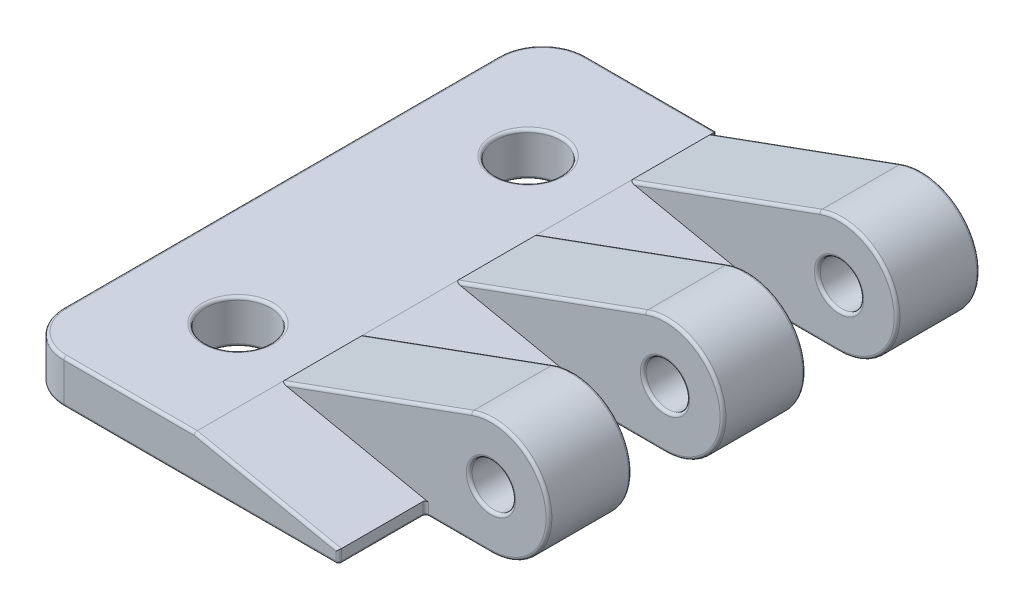
from build123d import *

# Parameters (mm, degrees)
CROQUIS1_R                    = 1.499999999999997
SALIENTE_EXTRUIR1_DEPTH       = 36
CORTAR_EXTRUIR1_DEPTH         = 6.3
MATRIZL1_COUNT                = 3
MATRIZL1_PITCH                = 12
CROQUIS3_R                    = 2.2500000000000053
CROQUIS3_R_2                  = 2.250000000000001
CORTAR_EXTRUIR2_DEPTH         = 48.41052288350405
REDONDEO1_R                   = 3
ESTRUSIONE_ESTRUSIONE1_START  = 0.3
ESTRUSIONE_ESTRUSIONE1_DEPTH  = 0.3
ESTRUSIONE_ESTRUSIONE2_START  = 0.3
ESTRUSIONE_ESTRUSIONE2_DEPTH  = 0.3
ESTRUSIONE_ESTRUSIONE3_START  = 0.3
ESTRUSIONE_ESTRUSIONE3_DEPTH  = 0.3
TAGLIO_ESTRUSIONE1_START      = -0.3
TAGLIO_ESTRUSIONE1_DEPTH      = 0.3
TAGLIO_ESTRUSIONE2_START      = -0.3
TAGLIO_ESTRUSIONE2_DEPTH      = 0.3
TAGLIO_ESTRUSIONE3_START      = -0.3
TAGLIO_ESTRUSIONE3_DEPTH      = 0.3
TAGLIO_ESTRUSIONE4_DEPTH      = 44.69036140943744
TAGLIO_ESTRUSIONE4_DEPTH_BACK = 44.69036140943744
SCHIZZO8_R                    = 1.499999999999997
TAGLIO_ESTRUSIONE5_DEPTH      = 48.82005520790687
TAGLIO_ESTRUSIONE5_DEPTH_BACK = 48.82005520790687
SCHIZZO9_W                    = 4.4999999999999964
SCHIZZO9_H                    = 6.299999999999999
RACCORDO4_R                   = 0.2


with BuildPart() as part:
    # Croquis1 → Saliente-Extruir1 (new body)
    with BuildSketch(Plane.XY):
        with BuildLine():
            Line((25.074614446804567, 7.758770483143642), (12, 3))
            Line((12, 3), (0, 3))
            Line((0, 3), (0, 0))
            Line((0, 0), (26.442695020107216, 8.7e-16))
            ThreePointArc((26.442695020107216, 8.7e-16), (30.381926032156052, 4.69459271066771), (25.074614446804567, 7.758770483143642))
        make_face()
        with Locations((26.442695020107216, 4.000000000000001)):
            Circle(CROQUIS1_R, mode=Mode.SUBTRACT)
    extrude(amount=-SALIENTE_EXTRUIR1_DEPTH)

    # Croquis2 → Cortar-Extruir1 (cut)
    with BuildSketch(Plane.XY):
        with BuildLine():
            Line((12, 3), (26.442695020107216, 8.7e-16))
            ThreePointArc((26.442695020107216, 8.7e-16), (30.381926032156052, 4.694592710667711), (25.074614446804564, 7.758770483143641))
            Line((25.074614446804564, 7.758770483143641), (12, 3))
        make_face()
    cortar_extruir1 = extrude(amount=-CORTAR_EXTRUIR1_DEPTH, mode=Mode.SUBTRACT)

    # MatrizL1: Cortar-Extruir1 ×3
    with Locations(*[(0, 0, -i * MATRIZL1_PITCH) for i in range(1, MATRIZL1_COUNT)]):
        add(cortar_extruir1, mode=Mode.SUBTRACT)

    # Croquis3 → Cortar-Extruir2 (cut, through all)
    with BuildSketch(Plane(origin=(0, 3, 0), x_dir=(1, 0, 0), z_dir=(0, 1, 0))):
        with Locations(Location((7, 27.999999999999996, 0), (0, 0, 270))):
            Circle(CROQUIS3_R)
        with Locations(Location((7.000000000000004, 7.9999999999999964, 0), (0, 0, 270))):
            Circle(CROQUIS3_R_2)
    extrude(amount=-CORTAR_EXTRUIR2_DEPTH, mode=Mode.SUBTRACT)

    # Redondeo1
    redondeo1_edges = [part.edges().sort_by_distance(p)[0] for p in [
        (0, 1.5, 0),
        (0, 1.5, -36),
    ]]
    fillet(redondeo1_edges, radius=REDONDEO1_R)

    # Schizzo2 → Estrusione-Estrusione1 (add)
    with BuildSketch(Plane.XY.offset(-6.3).offset(ESTRUSIONE_ESTRUSIONE1_START)):
        with BuildLine():
            Line((25.074614446804564, 7.758770483143641), (12, 3))
            Line((12, 3), (26.442695020107216, 2.6e-15))
            ThreePointArc((26.442695020107216, 2.6e-15), (30.38192603215605, 4.6945927106677106), (25.074614446804564, 7.758770483143641))
        make_face()
    extrude(amount=-ESTRUSIONE_ESTRUSIONE1_DEPTH)

    # Schizzo3 → Estrusione-Estrusione2 (add)
    with BuildSketch(Plane.XY.offset(-18.3).offset(ESTRUSIONE_ESTRUSIONE2_START)):
        with BuildLine():
            Line((25.074614446804564, 7.758770483143641), (12, 3))
            Line((12, 3), (26.442695020107216, 2.6e-15))
            ThreePointArc((26.442695020107216, 2.6e-15), (30.38192603215605, 4.6945927106677106), (25.074614446804564, 7.758770483143641))
        make_face()
    extrude(amount=-ESTRUSIONE_ESTRUSIONE2_DEPTH)

    # Schizzo4 → Estrusione-Estrusione3 (add)
    with BuildSketch(Plane.XY.offset(-30.3).offset(ESTRUSIONE_ESTRUSIONE3_START)):
        with BuildLine():
            Line((25.074614446804564, 7.758770483143641), (12, 3))
            Line((12, 3), (26.442695020107216, 2.6e-15))
            ThreePointArc((26.442695020107216, 2.6e-15), (30.38192603215605, 4.6945927106677106), (25.074614446804564, 7.758770483143641))
        make_face()
    extrude(amount=-ESTRUSIONE_ESTRUSIONE3_DEPTH)

    # Schizzo5 → Taglio-Estrusione1 (cut)
    with BuildSketch(Plane(origin=(0, 0, -36), x_dir=(-1, 0, 0), z_dir=(0, 0, -1)).offset(TAGLIO_ESTRUSIONE1_START)):
        with BuildLine():
            Line((-12, 3), (-12, 6e-16))
            Line((-12, 6e-16), (-26.442695020107216, 8.7e-16))
            ThreePointArc((-26.442695020107216, 8.7e-16), (-30.38192603215605, 4.694592710667711), (-25.074614446804564, 7.758770483143641))
            Line((-25.074614446804564, 7.758770483143641), (-12, 3))
        make_face()
    extrude(amount=TAGLIO_ESTRUSIONE1_DEPTH, mode=Mode.SUBTRACT)

    # Schizzo6 → Taglio-Estrusione2 (cut)
    with BuildSketch(Plane(origin=(0, 0, -24), x_dir=(-1, 0, 0), z_dir=(0, 0, -1)).offset(TAGLIO_ESTRUSIONE2_START)):
        with BuildLine():
            Line((-26.442695020107216, 2.6e-15), (-12, 3))
            Line((-12, 3), (-25.074614446804564, 7.758770483143642))
            ThreePointArc((-25.074614446804564, 7.758770483143642), (-30.38192603215605, 4.694592710667711), (-26.442695020107216, 2.6e-15))
        make_face()
    extrude(amount=TAGLIO_ESTRUSIONE2_DEPTH, mode=Mode.SUBTRACT)

    # Schizzo7 → Taglio-Estrusione3 (cut)
    with BuildSketch(Plane(origin=(0, 0, -12), x_dir=(-1, 0, 0), z_dir=(0, 0, -1)).offset(TAGLIO_ESTRUSIONE3_START)):
        with BuildLine():
            Line((-26.442695020107216, 2.6e-15), (-12, 3))
            Line((-12, 3), (-25.074614446804564, 7.758770483143642))
            ThreePointArc((-25.074614446804564, 7.758770483143642), (-30.38192603215605, 4.694592710667711), (-26.442695020107216, 2.6e-15))
        make_face()
    extrude(amount=TAGLIO_ESTRUSIONE3_DEPTH, mode=Mode.SUBTRACT)

    # Schizzo8 → Taglio-Estrusione4 (cut, two sides: drawn at the far end of the back side and taken through both)
    with BuildSketch(Plane(origin=(0, 0, -30.3), x_dir=(-1, 0, 0), z_dir=(0, 0, -1)).offset(-TAGLIO_ESTRUSIONE4_DEPTH_BACK)):
        with Locations(Location((-26.442695020107216, 4.000000000000001, 0), (0, 0, 180))):
            Circle(SCHIZZO8_R)
    extrude(amount=TAGLIO_ESTRUSIONE4_DEPTH + TAGLIO_ESTRUSIONE4_DEPTH_BACK, mode=Mode.SUBTRACT)

    # Schizzo9 → Taglio-Estrusione5 (cut, two sides: drawn at the far end of the back side and taken through both)
    with BuildSketch(Plane.XZ.offset(-TAGLIO_ESTRUSIONE5_DEPTH_BACK)):
        Polygon((26.442695020107216, 0), (21.942695020107216, 3e-17), (21.94269502010722, -6.000000000000001), (26.442695020107216, -6), align=None)
        with Locations((24.192695020107216, -14.850000000000001)):
            Rectangle(SCHIZZO9_W, SCHIZZO9_H)
        Polygon((26.442695020107216, -30), (21.94269502010722, -30), (21.94269502010722, -23.7), (26.44269502010722, -23.7), align=None)
    extrude(amount=TAGLIO_ESTRUSIONE5_DEPTH + TAGLIO_ESTRUSIONE5_DEPTH_BACK, mode=Mode.SUBTRACT)

    # Raccordo4
    # the kernel refuses this fillet: 0.2 mm, written as the material it adds along each edge
    with BuildSketch(Plane(origin=(21.94269502010722, 1.4347285933273, -6.000000000000001), x_dir=(1, 1.5e-16, 0), z_dir=(1.5e-16, -1, 0))) as raccordo4_piece_1_section:
        with BuildLine():
            CenterArc((RACCORDO4_R, RACCORDO4_R), RACCORDO4_R, 180, 90)
            Line((0, RACCORDO4_R), (0, 0))
            Line((0, 0), (RACCORDO4_R, 0))
        make_face()
    raccordo4_piece_1 = extrude(amount=1.4347285933273, mode=Mode.PRIVATE)
    raccordo4_piece_1 = split(raccordo4_piece_1, bisect_by=Plane(origin=(22.079693258381912, 0.9062716665382271, -5.9544744370320695), z_dir=(-0.20337630473670876, -0.979100647876224, 0)), keep=Keep.TOP, mode=Mode.PRIVATE)
    add(raccordo4_piece_1)
    with BuildSketch(Plane(origin=(21.94269502010722, 0, -18), x_dir=(1, 1.5e-16, 0), z_dir=(-1.5e-16, 1, 0))) as raccordo4_piece_2_section:
        with BuildLine():
            CenterArc((RACCORDO4_R, -RACCORDO4_R), RACCORDO4_R, 90, 90)
            Line((0, -RACCORDO4_R), (0, 0))
            Line((0, 0), (RACCORDO4_R, 0))
        make_face()
    raccordo4_piece_2 = extrude(amount=1.4347285933272929, mode=Mode.PRIVATE)
    raccordo4_piece_2 = split(raccordo4_piece_2, bisect_by=Plane(origin=(22.079693258381916, 0.9062716665382267, -17.954474437032072), z_dir=(-0.20337630473670876, -0.979100647876224, 0)), keep=Keep.TOP, mode=Mode.PRIVATE)
    add(raccordo4_piece_2)
    with BuildSketch(Plane(origin=(21.94269502010722, 0, -11.700000000000001), x_dir=(0, 0, -1), z_dir=(-1.5e-16, 1, 0))) as raccordo4_piece_3_section:
        with BuildLine():
            CenterArc((RACCORDO4_R, -RACCORDO4_R), RACCORDO4_R, 90, 90)
            Line((0, -RACCORDO4_R), (0, 0))
            Line((0, 0), (RACCORDO4_R, 0))
        make_face()
    raccordo4_piece_3 = extrude(amount=1.4347285933272929, mode=Mode.PRIVATE)
    raccordo4_piece_3 = split(raccordo4_piece_3, bisect_by=Plane(origin=(22.07969325838191, 0.906271666538228, -11.745525562967932), z_dir=(-0.20337630473670876, -0.979100647876224, 0)), keep=Keep.TOP, mode=Mode.PRIVATE)
    add(raccordo4_piece_3)
    with BuildSketch(Plane(origin=(21.94269502010722, 0, -30), x_dir=(1, 1.5e-16, 0), z_dir=(-1.5e-16, 1, 0))) as raccordo4_piece_4_section:
        with BuildLine():
            CenterArc((RACCORDO4_R, -RACCORDO4_R), RACCORDO4_R, 90, 90)
            Line((0, -RACCORDO4_R), (0, 0))
            Line((0, 0), (RACCORDO4_R, 0))
        make_face()
    raccordo4_piece_4 = extrude(amount=1.4347285933272929, mode=Mode.PRIVATE)
    raccordo4_piece_4 = split(raccordo4_piece_4, bisect_by=Plane(origin=(22.079693258381905, 0.9062716665382295, -29.954474437032065), z_dir=(-0.20337630473670862, -0.979100647876224, 0)), keep=Keep.TOP, mode=Mode.PRIVATE)
    add(raccordo4_piece_4)
    with BuildSketch(Plane(origin=(21.94269502010722, 0, -23.7), x_dir=(0, 0, -1), z_dir=(-1.5e-16, 1, 0))) as raccordo4_piece_5_section:
        with BuildLine():
            CenterArc((RACCORDO4_R, -RACCORDO4_R), RACCORDO4_R, 90, 90)
            Line((0, -RACCORDO4_R), (0, 0))
            Line((0, 0), (RACCORDO4_R, 0))
        make_face()
    raccordo4_piece_5 = extrude(amount=1.4347285933272929, mode=Mode.PRIVATE)
    raccordo4_piece_5 = split(raccordo4_piece_5, bisect_by=Plane(origin=(22.079693258381905, 0.9062716665382295, -23.745525562967927), z_dir=(-0.20337630473670862, -0.979100647876224, 0)), keep=Keep.TOP, mode=Mode.PRIVATE)
    add(raccordo4_piece_5)
    # the kernel refuses this fillet: 0.2 mm, written as the material it takes off along each edge
    with BuildSketch(Plane(origin=(11.8, 0.20000000000000062, -35.8), x_dir=(3e-17, -1, 0), z_dir=(0, 0, -1))) as raccordo4_2_piece_1_section:
        Polygon((0, 0), (RACCORDO4_R, 0), (RACCORDO4_R, -RACCORDO4_R), (1e-17, -RACCORDO4_R), align=None)
    raccordo4_2_piece_1 = extrude(amount=RACCORDO4_R, mode=Mode.PRIVATE)
    raccordo4_2_piece_1 = raccordo4_2_piece_1 - Plane(origin=(11.8, 0.20000000000000062, -35.8), x_dir=(-0.7071067811865475, 0.7071067811865475, 0), z_dir=(0, 0, -1)) * Sphere(RACCORDO4_R, mode=Mode.PRIVATE)
    add(raccordo4_2_piece_1, mode=Mode.SUBTRACT)
    with BuildSketch(Plane(origin=(12, 3.500000000000007, -36), x_dir=(0, 0, 1), z_dir=(0, -1, 0))) as raccordo4_2_piece_2:
        with BuildLine():
            CenterArc((RACCORDO4_R, RACCORDO4_R), RACCORDO4_R, 180, 90)
            Line((0, RACCORDO4_R), (0, 0))
            Line((0, 0), (RACCORDO4_R, 0))
        make_face()
    extrude(amount=3.3000000000000065, mode=Mode.SUBTRACT)
    with BuildSketch(Plane(origin=(26.442695020107216, 4.000000000000001, -35.7), x_dir=(0, -1, 0), z_dir=(-1, 0, 0))) as raccordo4_2_piece_3:
        with BuildLine():
            CenterArc((3.9999999999999987 - RACCORDO4_R, RACCORDO4_R), RACCORDO4_R, 270, 90)
            Line((3.9999999999999987 - RACCORDO4_R, 0), (3.9999999999999987, 0))
            Line((3.9999999999999987, 0), (3.9999999999999987, RACCORDO4_R))
        make_face()
    revolve(axis=Axis((26.442695020107216, 4.000000000000001, -35.7), (0, 0, 1)), revolution_arc=199.99999999999966, mode=Mode.SUBTRACT)
    with BuildSketch(Plane(origin=(25.074614446804564, 7.758770483143641, -35.7), x_dir=(0, 0, 1), z_dir=(-0.9396926207859105, -0.34202014332566305, 0))) as raccordo4_2_piece_4_section:
        with BuildLine():
            CenterArc((RACCORDO4_R, -RACCORDO4_R), RACCORDO4_R, 90, 90)
            Line((0, -RACCORDO4_R), (0, 0))
            Line((0, 0), (RACCORDO4_R, 0))
        make_face()
    raccordo4_2_piece_4 = extrude(amount=14.41371407798184, mode=Mode.PRIVATE)
    raccordo4_2_piece_4 = split(raccordo4_2_piece_4, bisect_by=Plane(origin=(18.610877853036175, 3, -35.654504046096996), z_dir=(0, 1, 0)), keep=Keep.TOP, mode=Mode.PRIVATE)
    raccordo4_2_piece_4 = split(raccordo4_2_piece_4, bisect_by=Plane(origin=(12, 5.358370188615012, -35.654504046096996), z_dir=(1, 0, 0)), keep=Keep.TOP, mode=Mode.PRIVATE)
    add(raccordo4_2_piece_4, mode=Mode.SUBTRACT)
    with BuildSketch(Plane(origin=(25.074614446804564, 7.758770483143641, -35.7), x_dir=(0, 0, 1), z_dir=(-0.9396926207859105, -0.34202014332566305, 0))) as raccordo4_2_piece_5_section:
        with BuildLine():
            CenterArc((RACCORDO4_R, -RACCORDO4_R), RACCORDO4_R, 90, 90)
            Line((0, -RACCORDO4_R), (0, 0))
            Line((0, 0), (RACCORDO4_R, 0))
        make_face()
    raccordo4_2_piece_5 = extrude(amount=14.41371407798184, mode=Mode.PRIVATE)
    raccordo4_2_piece_5 = split(raccordo4_2_piece_5, bisect_by=Plane(origin=(12.125758103896965, 3, -35.67870549355241), z_dir=(0, -1, 0)), keep=Keep.TOP, mode=Mode.PRIVATE)
    raccordo4_2_piece_5 = split(raccordo4_2_piece_5, bisect_by=Plane(origin=(12, 2.9542277945376503, -35.67870549355241), z_dir=(1, 0, 0)), keep=Keep.TOP, mode=Mode.PRIVATE)
    add(raccordo4_2_piece_5, mode=Mode.SUBTRACT)
    with BuildSketch(Plane(origin=(12, 6e-16, -35.7), x_dir=(0, -1.04e-15, 1), z_dir=(1, 2e-17, 0))) as raccordo4_2_piece_6:
        with BuildLine():
            CenterArc((RACCORDO4_R, -RACCORDO4_R), RACCORDO4_R, 89.99999999999994, 90.00000000000006)
            Line((-2.1e-16, -RACCORDO4_R), (0, 0))
            Line((0, 0), (RACCORDO4_R, 0))
        make_face()
    extrude(amount=14.442695020107216, mode=Mode.SUBTRACT)
    with BuildSketch(Plane(origin=(12, 6e-16, -35.7), x_dir=(-1, -1.04e-15, 0), z_dir=(0, 0, -1))) as raccordo4_2_piece_7:
        with BuildLine():
            CenterArc((RACCORDO4_R, RACCORDO4_R), RACCORDO4_R, 180, 90.00000000000006)
            Line((-2.1e-16, RACCORDO4_R), (0, 0))
            Line((0, 0), (RACCORDO4_R, 0))
        make_face()
    extrude(amount=0.09999999999999432, mode=Mode.SUBTRACT)
    with BuildSketch(Plane(origin=(26.442695020107216, 4.000000000000001, -35.7), x_dir=(1, 0, 0), z_dir=(0, -1, 0))) as raccordo4_2_piece_8:
        with BuildLine():
            CenterArc((1.4999999999999964 + RACCORDO4_R, RACCORDO4_R), RACCORDO4_R, 180, 90)
            Line((1.4999999999999964 + RACCORDO4_R, 0), (1.4999999999999964, 0))
            Line((1.4999999999999964, 0), (1.4999999999999964, RACCORDO4_R))
        make_face()
    revolve(axis=Axis((26.442695020107216, 4.000000000000001, -35.7), (0, 0, 1)), mode=Mode.SUBTRACT)
    with BuildSketch(Plane(origin=(26.442695020107216, 4.000000000000001, -23.7), x_dir=(1, 0, 0), z_dir=(0, -1, 0))) as raccordo4_2_piece_9:
        with BuildLine():
            CenterArc((1.4999999999999964 + RACCORDO4_R, RACCORDO4_R), RACCORDO4_R, 180, 90)
            Line((1.4999999999999964 + RACCORDO4_R, 0), (1.4999999999999964, 0))
            Line((1.4999999999999964, 0), (1.4999999999999964, RACCORDO4_R))
        make_face()
    revolve(axis=Axis((26.442695020107216, 4.000000000000001, -23.7), (0, 0, 1)), mode=Mode.SUBTRACT)
    with BuildSketch(Plane(origin=(26.442695020107216, 4.000000000000001, -11.7), x_dir=(1, 0, 0), z_dir=(0, -1, 0))) as raccordo4_2_piece_10:
        with BuildLine():
            CenterArc((1.4999999999999964 + RACCORDO4_R, RACCORDO4_R), RACCORDO4_R, 180, 90)
            Line((1.4999999999999964 + RACCORDO4_R, 0), (1.4999999999999964, 0))
            Line((1.4999999999999964, 0), (1.4999999999999964, RACCORDO4_R))
        make_face()
    revolve(axis=Axis((26.442695020107216, 4.000000000000001, -11.7), (0, 0, 1)), mode=Mode.SUBTRACT)
    with BuildSketch(Plane(origin=(26.442695020107216, 4.000000000000001, -6), x_dir=(1, 0, 0), z_dir=(0, 1, 0))) as raccordo4_2_piece_11:
        with BuildLine():
            CenterArc((1.4999999999999964 + RACCORDO4_R, RACCORDO4_R), RACCORDO4_R, 180, 90)
            Line((1.4999999999999964, RACCORDO4_R), (1.4999999999999964, 0))
            Line((1.4999999999999964, 0), (1.4999999999999964 + RACCORDO4_R, 0))
        make_face()
    revolve(axis=Axis((26.442695020107216, 4.000000000000001, -6), (0, 0, -1)), mode=Mode.SUBTRACT)
    with BuildSketch(Plane(origin=(26.442695020107216, 4.000000000000001, -18), x_dir=(1, 0, 0), z_dir=(0, 1, 0))) as raccordo4_2_piece_12:
        with BuildLine():
            CenterArc((1.4999999999999964 + RACCORDO4_R, RACCORDO4_R), RACCORDO4_R, 180, 90)
            Line((1.4999999999999964, RACCORDO4_R), (1.4999999999999964, 0))
            Line((1.4999999999999964, 0), (1.4999999999999964 + RACCORDO4_R, 0))
        make_face()
    revolve(axis=Axis((26.442695020107216, 4.000000000000001, -18), (0, 0, -1)), mode=Mode.SUBTRACT)
    with BuildSketch(Plane(origin=(26.442695020107216, 4.000000000000001, -30), x_dir=(1, 0, 0), z_dir=(0, 1, 0))) as raccordo4_2_piece_13:
        with BuildLine():
            CenterArc((1.4999999999999964 + RACCORDO4_R, RACCORDO4_R), RACCORDO4_R, 180, 90)
            Line((1.4999999999999964, RACCORDO4_R), (1.4999999999999964, 0))
            Line((1.4999999999999964, 0), (1.4999999999999964 + RACCORDO4_R, 0))
        make_face()
    revolve(axis=Axis((26.442695020107216, 4.000000000000001, -30), (0, 0, -1)), mode=Mode.SUBTRACT)
    with BuildSketch(Plane(origin=(21.942695020107216, 1.4347285933273, 0), x_dir=(-1, -1.5e-16, 0), z_dir=(1.5e-16, -1, 0))) as raccordo4_2_piece_14:
        with BuildLine():
            CenterArc((RACCORDO4_R, RACCORDO4_R), RACCORDO4_R, 180.00000000000003, 90)
            Line((0, RACCORDO4_R), (0, 0))
            Line((0, 0), (RACCORDO4_R, 0))
        make_face()
    extrude(amount=1.9347285933273, mode=Mode.SUBTRACT)
    with BuildSketch(Plane(origin=(11.510449676061889, 3.1016881523683546, 0), x_dir=(0, 0, -1), z_dir=(0.979100647876224, -0.20337630473670876, 0))) as raccordo4_2_piece_15:
        with BuildLine():
            CenterArc((RACCORDO4_R, -RACCORDO4_R), RACCORDO4_R, 90, 90)
            Line((-3e-17, -RACCORDO4_R), (0, 0))
            Line((0, 0), (RACCORDO4_R, 0))
        make_face()
    extrude(amount=11.154926402790158, mode=Mode.SUBTRACT)
    with BuildSketch(Plane(origin=(12.500000000000007, 3, -36), x_dir=(0, 0, 1), z_dir=(-1, 0, 0))) as raccordo4_2_piece_16:
        with BuildLine():
            CenterArc((RACCORDO4_R, -RACCORDO4_R), RACCORDO4_R, 90, 90)
            Line((0, -RACCORDO4_R), (0, 0))
            Line((0, 0), (RACCORDO4_R, 0))
        make_face()
    extrude(amount=9.500000000000007, mode=Mode.SUBTRACT)
    with BuildSketch(Plane(origin=(7, 4.4e-16, -27.999999999999996), x_dir=(0, 0, 1), z_dir=(-1, 0, 0))) as raccordo4_2_piece_17:
        with BuildLine():
            CenterArc((2.2500000000000036 + RACCORDO4_R, RACCORDO4_R), RACCORDO4_R, 179.9999999999999, 90.00000000000011)
            Line((2.2500000000000036, RACCORDO4_R), (2.2500000000000036, 0))
            Line((2.2500000000000036, 0), (2.2500000000000036 + RACCORDO4_R, -2.2e-16))
        make_face()
    revolve(axis=Axis((7, 4.4e-16, -27.999999999999996), (0, 1, 0)), mode=Mode.SUBTRACT)
    with BuildSketch(Plane(origin=(7, 3, -27.999999999999996), x_dir=(0, 0, 1), z_dir=(-1, 0, 0))) as raccordo4_2_piece_18:
        with BuildLine():
            CenterArc((2.2500000000000036 + RACCORDO4_R, -RACCORDO4_R), RACCORDO4_R, 90, 90)
            Line((2.2500000000000036, -RACCORDO4_R), (2.2500000000000036, 0))
            Line((2.2500000000000036, 0), (2.2500000000000036 + RACCORDO4_R, 0))
        make_face()
    revolve(axis=Axis((7, 3, -27.999999999999996), (0, 1, 0)), mode=Mode.SUBTRACT)
    with BuildSketch(Plane(origin=(7.000000000000004, 4.4e-16, -7.9999999999999964), x_dir=(0, 0, 1), z_dir=(-1, 0, 0))) as raccordo4_2_piece_19:
        with BuildLine():
            CenterArc((2.250000000000001 + RACCORDO4_R, RACCORDO4_R), RACCORDO4_R, 179.9999999999999, 90.00000000000011)
            Line((2.250000000000001, RACCORDO4_R), (2.250000000000001, 0))
            Line((2.250000000000001, 0), (2.250000000000001 + RACCORDO4_R, -2.2e-16))
        make_face()
    revolve(axis=Axis((7.000000000000004, 4.4e-16, -7.9999999999999964), (0, 1, 0)), mode=Mode.SUBTRACT)
    with BuildSketch(Plane(origin=(7.000000000000004, 3, -7.9999999999999964), x_dir=(0, 0, 1), z_dir=(-1, 0, 0))) as raccordo4_2_piece_20:
        with BuildLine():
            CenterArc((2.250000000000001 + RACCORDO4_R, -RACCORDO4_R), RACCORDO4_R, 90, 90)
            Line((2.250000000000001 + RACCORDO4_R, 0), (2.250000000000001, 0))
            Line((2.250000000000001, 0), (2.250000000000001, -RACCORDO4_R))
        make_face()
    revolve(axis=Axis((7.000000000000004, 3, -7.9999999999999964), (0, 1, 0)), mode=Mode.SUBTRACT)
    with BuildSketch(Plane(origin=(12.5, 3, 0), x_dir=(0, 0, -1), z_dir=(-1, 0, 0))) as raccordo4_2_piece_21:
        with BuildLine():
            CenterArc((RACCORDO4_R, RACCORDO4_R), RACCORDO4_R, 180, 90)
            Line((-3e-17, RACCORDO4_R), (0, 0))
            Line((0, 0), (RACCORDO4_R, 0))
        make_face()
    extrude(amount=9.5, mode=Mode.SUBTRACT)
    with BuildSketch(Plane(origin=(0, 3, -2.9999999999999996), x_dir=(1, 0, 0), z_dir=(0, 0, -1))) as raccordo4_2_piece_22:
        with BuildLine():
            CenterArc((RACCORDO4_R, RACCORDO4_R), RACCORDO4_R, 180, 90)
            Line((-7.2e-16, RACCORDO4_R), (0, 0))
            Line((0, 0), (RACCORDO4_R, 0))
        make_face()
    extrude(amount=30, mode=Mode.SUBTRACT)
    with BuildSketch(Plane(origin=(0, 0, -2.9999999999999996), x_dir=(1, 0, 0), z_dir=(0, 0, -1))) as raccordo4_2_piece_23:
        with BuildLine():
            CenterArc((RACCORDO4_R, -RACCORDO4_R), RACCORDO4_R, 90, 90.00000000000006)
            Line((-3e-17, -RACCORDO4_R), (0, 0))
            Line((0, 0), (RACCORDO4_R, 0))
        make_face()
    extrude(amount=30, mode=Mode.SUBTRACT)
    with BuildSketch(Plane(origin=(2.9999999999999996, 1e-16, 0), x_dir=(0, 6e-17, -1), z_dir=(1, 3e-17, 0))) as raccordo4_2_piece_24:
        with BuildLine():
            CenterArc((RACCORDO4_R, RACCORDO4_R), RACCORDO4_R, 180, 90)
            Line((-2e-17, RACCORDO4_R), (0, 0))
            Line((0, 0), (RACCORDO4_R, 0))
        make_face()
    extrude(amount=19.442695020107216, mode=Mode.SUBTRACT)
    with BuildSketch(Plane(origin=(2.9999999999999996, 1e-16, -36), x_dir=(0, 6e-17, 1), z_dir=(1, 3e-17, 0))) as raccordo4_2_piece_25:
        with BuildLine():
            CenterArc((RACCORDO4_R, -RACCORDO4_R), RACCORDO4_R, 90, 90)
            Line((1e-17, -RACCORDO4_R), (0, 0))
            Line((0, 0), (RACCORDO4_R, 0))
        make_face()
    extrude(amount=8.8, mode=Mode.SUBTRACT)
    with BuildSketch(Plane(origin=(2.9999999999999996, 0, -2.9999999999999996), x_dir=(-1, 0, 0), z_dir=(0, 0, -1))) as raccordo4_2_piece_26:
        with BuildLine():
            CenterArc((3 - RACCORDO4_R, RACCORDO4_R), RACCORDO4_R, 270, 90.00000000000004)
            Line((3, RACCORDO4_R), (3, 0))
            Line((3, 0), (3 - RACCORDO4_R, 0))
        make_face()
    revolve(axis=Axis((2.9999999999999996, 0, -2.9999999999999996), (0, 1, 0)), revolution_arc=90, mode=Mode.SUBTRACT)
    with BuildSketch(Plane(origin=(2.9999999999999996, 0, -33), x_dir=(-1, 0, 0), z_dir=(0, 0, 1))) as raccordo4_2_piece_27:
        with BuildLine():
            CenterArc((3 - RACCORDO4_R, -RACCORDO4_R), RACCORDO4_R, 359.99999999999994, 90.00000000000006)
            Line((3, -RACCORDO4_R), (3, 0))
            Line((3, 0), (3 - RACCORDO4_R, 0))
        make_face()
    revolve(axis=Axis((2.9999999999999996, 0, -33), (0, -1, 0)), revolution_arc=90, mode=Mode.SUBTRACT)
    with BuildSketch(Plane(origin=(2.9999999999999996, 3, -2.9999999999999996), x_dir=(-1, 0, 0), z_dir=(0, 0, -1))) as raccordo4_2_piece_28:
        with BuildLine():
            CenterArc((3 - RACCORDO4_R, -RACCORDO4_R), RACCORDO4_R, 0, 90)
            Line((3.0000000000000004, -RACCORDO4_R), (3, 0))
            Line((3, 0), (3 - RACCORDO4_R, 0))
        make_face()
    revolve(axis=Axis((2.9999999999999996, 3, -2.9999999999999996), (0, 1, 0)), revolution_arc=90, mode=Mode.SUBTRACT)
    with BuildSketch(Plane(origin=(2.9999999999999996, 3, -33), x_dir=(-1, 0, 0), z_dir=(0, 0, 1))) as raccordo4_2_piece_29:
        with BuildLine():
            CenterArc((3 - RACCORDO4_R, RACCORDO4_R), RACCORDO4_R, 270, 90)
            Line((3.0000000000000004, RACCORDO4_R), (3, 0))
            Line((3, 0), (3 - RACCORDO4_R, 0))
        make_face()
    revolve(axis=Axis((2.9999999999999996, 3, -33), (0, -1, 0)), revolution_arc=90, mode=Mode.SUBTRACT)
    with BuildSketch(Plane(origin=(12, 3.9e-16, -35.199999999999996), x_dir=(-1, -3e-17, 0), z_dir=(0, 0, -1))) as raccordo4_2_piece_30a_section:
        with BuildLine():
            CenterArc((RACCORDO4_R, RACCORDO4_R), RACCORDO4_R, 180.00000000000006, 89.99999999999994)
            Line((-1e-17, RACCORDO4_R), (0, 0))
            Line((0, 0), (RACCORDO4_R, 0))
        make_face()
    raccordo4_2_piece_30a = extrude(amount=0.6000000000000014, mode=Mode.PRIVATE)
    raccordo4_2_piece_30a = split(raccordo4_2_piece_30a, bisect_by=Plane(origin=(11.954720977146634, 0.04527902285336483, -35.7), z_dir=(0, 0, 1)), keep=Keep.TOP, mode=Mode.PRIVATE)
    with BuildSketch(Plane(origin=(11.499999999999993, 3.8e-16, -35.7), x_dir=(0, 6e-17, 1), z_dir=(1, 2e-17, 0))) as raccordo4_2_piece_30b_section:
        with BuildLine():
            CenterArc((RACCORDO4_R, -RACCORDO4_R), RACCORDO4_R, 90, 89.99999999999994)
            Line((1e-17, -RACCORDO4_R), (0, 0))
            Line((0, 0), (RACCORDO4_R, 0))
        make_face()
    raccordo4_2_piece_30b = extrude(amount=14.942695020107223, mode=Mode.PRIVATE)
    raccordo4_2_piece_30b = split(raccordo4_2_piece_30b, bisect_by=Plane(origin=(12, 0.04527902285336394, -35.65472097714663), z_dir=(-1, 0, 0)), keep=Keep.TOP, mode=Mode.PRIVATE)
    raccordo4_2_piece_30 = raccordo4_2_piece_30a & raccordo4_2_piece_30b
    add(raccordo4_2_piece_30, mode=Mode.SUBTRACT)
    # the kernel refuses this fillet: 0.2 mm, written as the material it takes off along each edge
    with BuildSketch(Plane(origin=(21.742695020107217, 0.20000000000000073, -0.2), x_dir=(1, 1.1e-16, 5.9e-16), z_dir=(3e-17, -1, 0))) as raccordo4_3_piece_1_section:
        Polygon((0, 0), (RACCORDO4_R, 0), (RACCORDO4_R, RACCORDO4_R), (1.2e-16, RACCORDO4_R), align=None)
    raccordo4_3_piece_1 = extrude(amount=RACCORDO4_R, mode=Mode.PRIVATE)
    raccordo4_3_piece_1 = raccordo4_3_piece_1 - Plane(origin=(21.742695020107217, 0.20000000000000073, -0.2), x_dir=(-0.7071067811865472, 0, -0.7071067811865477), z_dir=(3e-17, -1, 0)) * Sphere(RACCORDO4_R, mode=Mode.PRIVATE)
    add(raccordo4_3_piece_1, mode=Mode.SUBTRACT)
    with BuildSketch(Plane(origin=(26.442695020107216, 4.000000000000002, -30), x_dir=(0, -1, 0), z_dir=(-1, 0, 0))) as raccordo4_3_piece_2:
        with BuildLine():
            CenterArc((3.999999999999998 - RACCORDO4_R, -RACCORDO4_R), RACCORDO4_R, 0, 90)
            Line((3.999999999999998, -RACCORDO4_R), (3.999999999999998, 0))
            Line((3.999999999999998, 0), (3.999999999999998 - RACCORDO4_R, 0))
        make_face()
    revolve(axis=Axis((26.442695020107216, 4.000000000000002, -30), (0, 0, 1)), revolution_arc=199.99999999999966, mode=Mode.SUBTRACT)
    with BuildSketch(Plane(origin=(25.074614446804564, 7.758770483143641, -30), x_dir=(0, 0, -1), z_dir=(-0.9396926207859105, -0.34202014332566305, 0))) as raccordo4_3_piece_3_section:
        with BuildLine():
            CenterArc((RACCORDO4_R, RACCORDO4_R), RACCORDO4_R, 180, 90)
            Line((0, RACCORDO4_R), (0, 0))
            Line((0, 0), (RACCORDO4_R, 0))
        make_face()
    raccordo4_3_piece_3 = extrude(amount=14.413714077981835, mode=Mode.PRIVATE)
    raccordo4_3_piece_3 = split(raccordo4_3_piece_3, bisect_by=Plane(origin=(18.610725843212062, 3, -30.0454971607224), z_dir=(0, 1, 0)), keep=Keep.TOP, mode=Mode.PRIVATE)
    raccordo4_3_piece_3 = split(raccordo4_3_piece_3, bisect_by=Plane(origin=(17.867691786604922, 1.7811779356063644, -30.0454971607224), z_dir=(0.20337630473670862, 0.979100647876224, 0)), keep=Keep.TOP, mode=Mode.PRIVATE)
    add(raccordo4_3_piece_3, mode=Mode.SUBTRACT)
    with BuildSketch(Plane(origin=(25.074614446804564, 7.758770483143641, -30), x_dir=(0, 0, -1), z_dir=(-0.9396926207859105, -0.34202014332566305, 0))) as raccordo4_3_piece_4_section:
        with BuildLine():
            CenterArc((RACCORDO4_R, RACCORDO4_R), RACCORDO4_R, 180, 90)
            Line((0, RACCORDO4_R), (0, 0))
            Line((0, 0), (RACCORDO4_R, 0))
        make_face()
    raccordo4_3_piece_4 = extrude(amount=14.413714077981835, mode=Mode.PRIVATE)
    raccordo4_3_piece_4 = split(raccordo4_3_piece_4, bisect_by=Plane(origin=(12.205823207767121, 3, -30.02129445481686), z_dir=(0, -1, 0)), keep=Keep.TOP, mode=Mode.PRIVATE)
    raccordo4_3_piece_4 = split(raccordo4_3_piece_4, bisect_by=Plane(origin=(12.200621610424015, 2.9583273876216225, -30.02129445481686), z_dir=(0.20337630473670862, 0.979100647876224, 0)), keep=Keep.TOP, mode=Mode.PRIVATE)
    add(raccordo4_3_piece_4, mode=Mode.SUBTRACT)
    with BuildSketch(Plane(origin=(26.442695020107216, 4.000000000000002, -23.7), x_dir=(0, -1, 0), z_dir=(-1, 0, 0))) as raccordo4_3_piece_5:
        with BuildLine():
            CenterArc((3.9999999999999987 - RACCORDO4_R, RACCORDO4_R), RACCORDO4_R, 269.9999999999998, 90.00000000000023)
            Line((3.9999999999999987 - RACCORDO4_R, 0), (3.9999999999999987, 0))
            Line((3.9999999999999987, 0), (3.9999999999999996, RACCORDO4_R))
        make_face()
    revolve(axis=Axis((26.442695020107216, 4.000000000000002, -23.7), (0, 0, 1)), revolution_arc=199.99999999999966, mode=Mode.SUBTRACT)
    with BuildSketch(Plane(origin=(11.530153689607047, 2.82898992833717, -23.7), x_dir=(-1.1e-15, 3.03e-15, 1), z_dir=(0.9396926207859104, 0.34202014332566316, 0))) as raccordo4_3_piece_6_section:
        with BuildLine():
            CenterArc((RACCORDO4_R, RACCORDO4_R), RACCORDO4_R, 180.0000000000001, 90.00000000000006)
            Line((-6.4e-16, RACCORDO4_R), (0, 0))
            Line((0, 0), (RACCORDO4_R, 0))
        make_face()
    raccordo4_3_piece_6 = extrude(amount=14.413714077981828, mode=Mode.PRIVATE)
    raccordo4_3_piece_6 = split(raccordo4_3_piece_6, bisect_by=Plane(origin=(12.205823207767459, 3, -23.678705545183462), z_dir=(0, -1, 0)), keep=Keep.TOP, mode=Mode.PRIVATE)
    raccordo4_3_piece_6 = split(raccordo4_3_piece_6, bisect_by=Plane(origin=(12.200621610424346, 2.9583273876215532, -23.678705545183462), z_dir=(0.20337630473670862, 0.979100647876224, 0)), keep=Keep.TOP, mode=Mode.PRIVATE)
    add(raccordo4_3_piece_6, mode=Mode.SUBTRACT)
    with BuildSketch(Plane(origin=(11.530153689607047, 2.82898992833717, -23.7), x_dir=(-1.1e-15, 3.03e-15, 1), z_dir=(0.9396926207859104, 0.34202014332566316, 0))) as raccordo4_3_piece_7_section:
        with BuildLine():
            CenterArc((RACCORDO4_R, RACCORDO4_R), RACCORDO4_R, 180.0000000000001, 90.00000000000006)
            Line((-6.4e-16, RACCORDO4_R), (0, 0))
            Line((0, 0), (RACCORDO4_R, 0))
        make_face()
    raccordo4_3_piece_7 = extrude(amount=14.413714077981828, mode=Mode.PRIVATE)
    raccordo4_3_piece_7 = split(raccordo4_3_piece_7, bisect_by=Plane(origin=(18.61072584321218, 3, -23.6545028392776), z_dir=(0, 1, 0)), keep=Keep.TOP, mode=Mode.PRIVATE)
    raccordo4_3_piece_7 = split(raccordo4_3_piece_7, bisect_by=Plane(origin=(17.86769178660502, 1.7811779356063435, -23.6545028392776), z_dir=(0.20337630473670862, 0.979100647876224, 0)), keep=Keep.TOP, mode=Mode.PRIVATE)
    add(raccordo4_3_piece_7, mode=Mode.SUBTRACT)
    with BuildSketch(Plane(origin=(26.442695020107216, 4.000000000000002, -11.7), x_dir=(0, -1, 0), z_dir=(-1, 0, 0))) as raccordo4_3_piece_8:
        with BuildLine():
            CenterArc((3.9999999999999987 - RACCORDO4_R, RACCORDO4_R), RACCORDO4_R, 270.0000000000002, 89.99999999999977)
            Line((3.9999999999999987 - RACCORDO4_R, 0), (3.9999999999999987, 0))
            Line((3.9999999999999987, 0), (3.999999999999998, RACCORDO4_R))
        make_face()
    revolve(axis=Axis((26.442695020107216, 4.000000000000002, -11.7), (0, 0, 1)), revolution_arc=199.99999999999966, mode=Mode.SUBTRACT)
    with BuildSketch(Plane(origin=(11.530153689607047, 2.82898992833717, -11.700000000000001), x_dir=(3.3e-16, -8.9e-16, 1), z_dir=(0.9396926207859104, 0.34202014332566316, 0))) as raccordo4_3_piece_9_section:
        with BuildLine():
            CenterArc((RACCORDO4_R, RACCORDO4_R), RACCORDO4_R, 180.0000000000001, 89.99999999999983)
            Line((1.9e-16, RACCORDO4_R), (0, 0))
            Line((0, 0), (RACCORDO4_R, 0))
        make_face()
    raccordo4_3_piece_9 = extrude(amount=14.413714077981828, mode=Mode.PRIVATE)
    raccordo4_3_piece_9 = split(raccordo4_3_piece_9, bisect_by=Plane(origin=(12.205823207767432, 3, -11.67870554518345), z_dir=(0, -1, 0)), keep=Keep.TOP, mode=Mode.PRIVATE)
    raccordo4_3_piece_9 = split(raccordo4_3_piece_9, bisect_by=Plane(origin=(12.20062161042432, 2.9583273876215594, -11.67870554518345), z_dir=(0.20337630473670876, 0.979100647876224, 0)), keep=Keep.TOP, mode=Mode.PRIVATE)
    add(raccordo4_3_piece_9, mode=Mode.SUBTRACT)
    with BuildSketch(Plane(origin=(11.530153689607047, 2.82898992833717, -11.700000000000001), x_dir=(3.3e-16, -8.9e-16, 1), z_dir=(0.9396926207859104, 0.34202014332566316, 0))) as raccordo4_3_piece_10_section:
        with BuildLine():
            CenterArc((RACCORDO4_R, RACCORDO4_R), RACCORDO4_R, 180.0000000000001, 89.99999999999983)
            Line((1.9e-16, RACCORDO4_R), (0, 0))
            Line((0, 0), (RACCORDO4_R, 0))
        make_face()
    raccordo4_3_piece_10 = extrude(amount=14.413714077981828, mode=Mode.PRIVATE)
    raccordo4_3_piece_10 = split(raccordo4_3_piece_10, bisect_by=Plane(origin=(18.610725843212133, 3, -11.654502839277603), z_dir=(0, 1, 0)), keep=Keep.TOP, mode=Mode.PRIVATE)
    raccordo4_3_piece_10 = split(raccordo4_3_piece_10, bisect_by=Plane(origin=(17.86769178660498, 1.7811779356063522, -11.654502839277603), z_dir=(0.20337630473670876, 0.979100647876224, 0)), keep=Keep.TOP, mode=Mode.PRIVATE)
    add(raccordo4_3_piece_10, mode=Mode.SUBTRACT)
    with BuildSketch(Plane(origin=(21.94269502010722, 7.2e-16, -5.800000000000001), x_dir=(-1, 1e-17, -5.9e-16), z_dir=(-5.9e-16, 0, 1))) as raccordo4_3_piece_11:
        with BuildLine():
            CenterArc((RACCORDO4_R, -RACCORDO4_R), RACCORDO4_R, 90, 90)
            Line((0, -RACCORDO4_R), (0, 0))
            Line((0, 0), (RACCORDO4_R, 0))
        make_face()
    extrude(amount=5.6000000000000005, mode=Mode.SUBTRACT)
    with BuildSketch(Plane(origin=(26.442695020107216, 8.7e-16, -6.000000000000001), x_dir=(2e-16, -3e-17, -1), z_dir=(-1, -3e-17, -2e-16))) as raccordo4_3_piece_12:
        with BuildLine():
            CenterArc((RACCORDO4_R, -RACCORDO4_R), RACCORDO4_R, 90, 90)
            Line((-1e-17, -RACCORDO4_R), (0, 0))
            Line((0, 0), (RACCORDO4_R, 0))
        make_face()
    extrude(amount=4.299999999999997, mode=Mode.SUBTRACT)
    with BuildSketch(Plane(origin=(26.442695020107216, 8.7e-16, -11.700000000000001), x_dir=(0, -3e-17, 1), z_dir=(-1, -3e-17, 0)), Plane(origin=(26.442695020107216, 8.7e-16, -23.7), x_dir=(0, -3e-17, 1), z_dir=(-1, -3e-17, 0))) as raccordo4_3_piece_13:
        with BuildLine():
            CenterArc((RACCORDO4_R, RACCORDO4_R), RACCORDO4_R, 180, 90)
            Line((-1e-17, RACCORDO4_R), (0, 0))
            Line((0, 0), (RACCORDO4_R, 0))
        make_face()
    extrude(amount=4.299999999999997, mode=Mode.SUBTRACT)
    with BuildSketch(Plane(origin=(21.94269502010722, 7.2e-16, -11.9), x_dir=(-1, 1e-17, 0), z_dir=(0, 0, -1))) as raccordo4_3_piece_14:
        with BuildLine():
            CenterArc((RACCORDO4_R, RACCORDO4_R), RACCORDO4_R, 180, 90)
            Line((0, RACCORDO4_R), (0, 0))
            Line((0, 0), (RACCORDO4_R, 0))
        make_face()
    extrude(amount=5.9, mode=Mode.SUBTRACT)
    with BuildSketch(Plane(origin=(22.14269502010722, 7.3e-16, -18), x_dir=(0, -2e-17, -1), z_dir=(1, 3e-17, 0)), Plane(origin=(22.14269502010722, 7.3e-16, -30), x_dir=(0, -2e-17, -1), z_dir=(1, 3e-17, 0))) as raccordo4_3_piece_15:
        with BuildLine():
            CenterArc((RACCORDO4_R, RACCORDO4_R), RACCORDO4_R, 180, 90)
            Line((0, RACCORDO4_R), (0, 0))
            Line((0, 0), (RACCORDO4_R, 0))
        make_face()
    extrude(amount=4.299999999999997, mode=Mode.SUBTRACT)
    with BuildSketch(Plane(origin=(21.94269502010722, 7.2e-16, -23.9), x_dir=(-1, 1e-17, 0), z_dir=(0, 0, -1))) as raccordo4_3_piece_16:
        with BuildLine():
            CenterArc((RACCORDO4_R, RACCORDO4_R), RACCORDO4_R, 180, 90)
            Line((0, RACCORDO4_R), (0, 0))
            Line((0, 0), (RACCORDO4_R, 0))
        make_face()
    extrude(amount=5.900000000000002, mode=Mode.SUBTRACT)
    with BuildSketch(Plane(origin=(26.442695020107216, 4.000000000000002, -6), x_dir=(0, -1, 0), z_dir=(-1, 0, 0))) as raccordo4_3_piece_17:
        with BuildLine():
            CenterArc((3.999999999999998 - RACCORDO4_R, -RACCORDO4_R), RACCORDO4_R, 0, 90)
            Line((3.999999999999998, -RACCORDO4_R), (3.999999999999998, 0))
            Line((3.999999999999998, 0), (3.999999999999998 - RACCORDO4_R, 0))
        make_face()
    revolve(axis=Axis((26.442695020107216, 4.000000000000002, -6), (0, 0, 1)), revolution_arc=199.99999999999966, mode=Mode.SUBTRACT)
    with BuildSketch(Plane(origin=(25.074614446804564, 7.758770483143641, -6), x_dir=(0, 0, -1), z_dir=(-0.9396926207859105, -0.34202014332566305, 0))) as raccordo4_3_piece_18_section:
        with BuildLine():
            CenterArc((RACCORDO4_R, RACCORDO4_R), RACCORDO4_R, 180, 90)
            Line((0, RACCORDO4_R), (0, 0))
            Line((0, 0), (RACCORDO4_R, 0))
        make_face()
    raccordo4_3_piece_18 = extrude(amount=14.413714077981835, mode=Mode.PRIVATE)
    raccordo4_3_piece_18 = split(raccordo4_3_piece_18, bisect_by=Plane(origin=(18.610725843212002, 3, -6.045497160722398), z_dir=(0, 1, 0)), keep=Keep.TOP, mode=Mode.PRIVATE)
    raccordo4_3_piece_18 = split(raccordo4_3_piece_18, bisect_by=Plane(origin=(17.867691786604865, 1.7811779356063755, -6.045497160722398), z_dir=(0.20337630473670876, 0.979100647876224, 0)), keep=Keep.TOP, mode=Mode.PRIVATE)
    add(raccordo4_3_piece_18, mode=Mode.SUBTRACT)
    with BuildSketch(Plane(origin=(25.074614446804564, 7.758770483143641, -6), x_dir=(0, 0, -1), z_dir=(-0.9396926207859105, -0.34202014332566305, 0))) as raccordo4_3_piece_19_section:
        with BuildLine():
            CenterArc((RACCORDO4_R, RACCORDO4_R), RACCORDO4_R, 180, 90)
            Line((0, RACCORDO4_R), (0, 0))
            Line((0, 0), (RACCORDO4_R, 0))
        make_face()
    raccordo4_3_piece_19 = extrude(amount=14.413714077981835, mode=Mode.PRIVATE)
    raccordo4_3_piece_19 = split(raccordo4_3_piece_19, bisect_by=Plane(origin=(12.205823207767137, 3, -6.0212944548168545), z_dir=(0, -1, 0)), keep=Keep.TOP, mode=Mode.PRIVATE)
    raccordo4_3_piece_19 = split(raccordo4_3_piece_19, bisect_by=Plane(origin=(12.200621610424031, 2.95832738762162, -6.0212944548168545), z_dir=(0.20337630473670876, 0.979100647876224, 0)), keep=Keep.TOP, mode=Mode.PRIVATE)
    add(raccordo4_3_piece_19, mode=Mode.SUBTRACT)
    with BuildSketch(Plane(origin=(26.442695020107216, 4.000000000000002, -18), x_dir=(0, -1, 0), z_dir=(-1, 0, 0))) as raccordo4_3_piece_20:
        with BuildLine():
            CenterArc((3.999999999999998 - RACCORDO4_R, -RACCORDO4_R), RACCORDO4_R, 0, 90)
            Line((3.999999999999998, -RACCORDO4_R), (3.999999999999998, 0))
            Line((3.999999999999998, 0), (3.999999999999998 - RACCORDO4_R, 0))
        make_face()
    revolve(axis=Axis((26.442695020107216, 4.000000000000002, -18), (0, 0, 1)), revolution_arc=199.99999999999966, mode=Mode.SUBTRACT)
    with BuildSketch(Plane(origin=(25.074614446804564, 7.758770483143641, -18), x_dir=(0, 0, -1), z_dir=(-0.9396926207859105, -0.34202014332566305, 0))) as raccordo4_3_piece_21_section:
        with BuildLine():
            CenterArc((RACCORDO4_R, RACCORDO4_R), RACCORDO4_R, 180, 90)
            Line((0, RACCORDO4_R), (0, 0))
            Line((0, 0), (RACCORDO4_R, 0))
        make_face()
    raccordo4_3_piece_21 = extrude(amount=14.413714077981835, mode=Mode.PRIVATE)
    raccordo4_3_piece_21 = split(raccordo4_3_piece_21, bisect_by=Plane(origin=(18.610725843212066, 3, -18.045497160722395), z_dir=(0, 1, 0)), keep=Keep.TOP, mode=Mode.PRIVATE)
    raccordo4_3_piece_21 = split(raccordo4_3_piece_21, bisect_by=Plane(origin=(17.867691786604922, 1.7811779356063644, -18.045497160722395), z_dir=(0.20337630473670876, 0.979100647876224, 0)), keep=Keep.TOP, mode=Mode.PRIVATE)
    add(raccordo4_3_piece_21, mode=Mode.SUBTRACT)
    with BuildSketch(Plane(origin=(25.074614446804564, 7.758770483143641, -18), x_dir=(0, 0, -1), z_dir=(-0.9396926207859105, -0.34202014332566305, 0))) as raccordo4_3_piece_22_section:
        with BuildLine():
            CenterArc((RACCORDO4_R, RACCORDO4_R), RACCORDO4_R, 180, 90)
            Line((0, RACCORDO4_R), (0, 0))
            Line((0, 0), (RACCORDO4_R, 0))
        make_face()
    raccordo4_3_piece_22 = extrude(amount=14.413714077981835, mode=Mode.PRIVATE)
    raccordo4_3_piece_22 = split(raccordo4_3_piece_22, bisect_by=Plane(origin=(12.205823207767109, 3, -18.021294454816854), z_dir=(0, -1, 0)), keep=Keep.TOP, mode=Mode.PRIVATE)
    raccordo4_3_piece_22 = split(raccordo4_3_piece_22, bisect_by=Plane(origin=(12.200621610424001, 2.958327387621626, -18.021294454816854), z_dir=(0.20337630473670876, 0.979100647876224, 0)), keep=Keep.TOP, mode=Mode.PRIVATE)
    add(raccordo4_3_piece_22, mode=Mode.SUBTRACT)
    with BuildSketch(Plane(origin=(22.14269502010722, 3e-17, -29.8), x_dir=(0, 0, -1), z_dir=(1, 1.5e-16, 0))) as raccordo4_3_piece_23:
        with BuildLine():
            CenterArc((0.1999999999999993 + RACCORDO4_R, RACCORDO4_R), RACCORDO4_R, 180.0000000000002, 89.99999999999977)
            Line((0.1999999999999993, RACCORDO4_R), (0.1999999999999993, 0))
            Line((0.1999999999999993, 0), (0.1999999999999993 + RACCORDO4_R, 6.9e-16))
        make_face()
    revolve(axis=Axis((22.14269502010722, 3e-17, -29.8), (-1.5e-16, 1, 0)), revolution_arc=90, mode=Mode.SUBTRACT)
    with BuildSketch(Plane(origin=(22.14269502010722, 3e-17, -23.9), x_dir=(-1, -1.5e-16, 0), z_dir=(0, 0, -1))) as raccordo4_3_piece_24:
        with BuildLine():
            CenterArc((0.1999999999999993 + RACCORDO4_R, RACCORDO4_R), RACCORDO4_R, 180.0000000000002, 89.99999999999983)
            Line((0.19999999999999926, RACCORDO4_R), (0.1999999999999993, 0))
            Line((0.1999999999999993, 0), (0.1999999999999993 + RACCORDO4_R, 7.5e-16))
        make_face()
    revolve(axis=Axis((22.14269502010722, 3e-17, -23.9), (-1.5e-16, 1, 0)), revolution_arc=90, mode=Mode.SUBTRACT)
    with BuildSketch(Plane(origin=(22.14269502010722, 3e-17, -17.8), x_dir=(0, 0, -1), z_dir=(1, 1.5e-16, 0))) as raccordo4_3_piece_25:
        with BuildLine():
            CenterArc((0.1999999999999993 + RACCORDO4_R, RACCORDO4_R), RACCORDO4_R, 180.0000000000002, 89.99999999999977)
            Line((0.1999999999999993, RACCORDO4_R), (0.1999999999999993, 0))
            Line((0.1999999999999993, 0), (0.1999999999999993 + RACCORDO4_R, 6.9e-16))
        make_face()
    revolve(axis=Axis((22.14269502010722, 3e-17, -17.8), (-1.5e-16, 1, 0)), revolution_arc=90, mode=Mode.SUBTRACT)
    with BuildSketch(Plane(origin=(22.14269502010722, 3e-17, -11.9), x_dir=(-1, -1.5e-16, 0), z_dir=(0, 0, -1))) as raccordo4_3_piece_26:
        with BuildLine():
            CenterArc((0.1999999999999993 + RACCORDO4_R, RACCORDO4_R), RACCORDO4_R, 180.0000000000002, 89.99999999999983)
            Line((0.19999999999999926, RACCORDO4_R), (0.1999999999999993, 0))
            Line((0.1999999999999993, 0), (0.1999999999999993 + RACCORDO4_R, 7.5e-16))
        make_face()
    revolve(axis=Axis((22.14269502010722, 3e-17, -11.9), (-1.5e-16, 1, 0)), revolution_arc=90, mode=Mode.SUBTRACT)
    with BuildSketch(Plane(origin=(22.14269502010722, 0, -5.800000000000001), x_dir=(0, 0, -1), z_dir=(1, 1.5e-16, 0))) as raccordo4_3_piece_27:
        with BuildLine():
            CenterArc((0.20000000000000018 + RACCORDO4_R, RACCORDO4_R), RACCORDO4_R, 180.00000000000014, 89.99999999999989)
            Line((0.20000000000000018, RACCORDO4_R), (0.20000000000000018, 0))
            Line((0.20000000000000018, 0), (0.20000000000000018 + RACCORDO4_R, 7.2e-16))
        make_face()
    revolve(axis=Axis((22.14269502010722, 0, -5.800000000000001), (-1.5e-16, 1, 0)), revolution_arc=90, mode=Mode.SUBTRACT)


solid = part.part
